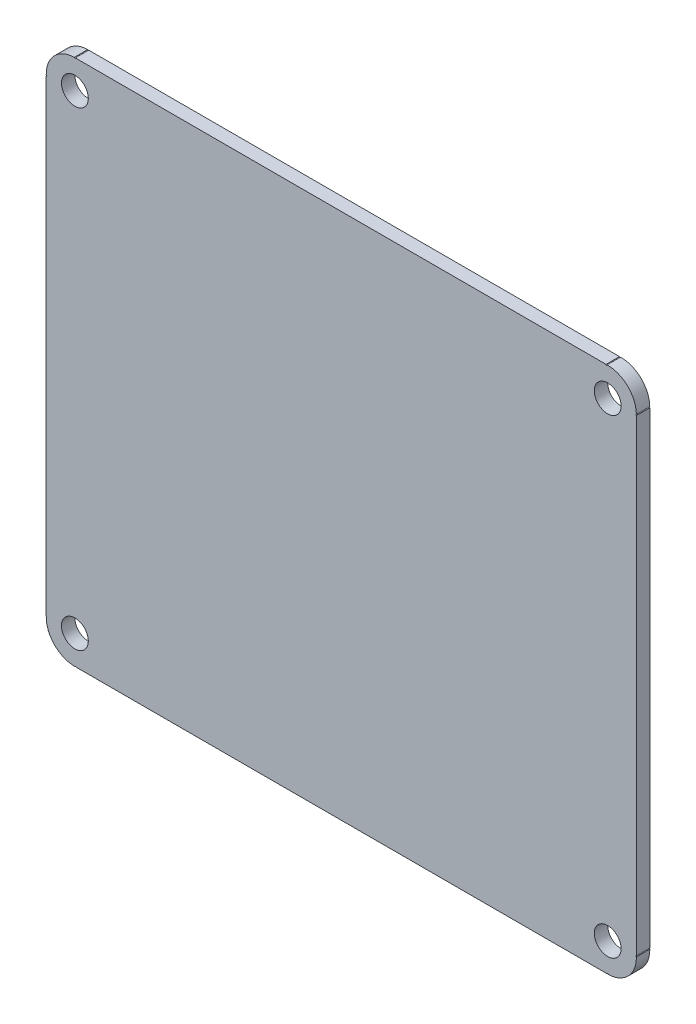
from build123d import *

# Parameters (mm, degrees)
EXTRUDE_1_DEPTH     = 1.6
VIAHOLELAYER_R      = 1.6
CUT_EXTRUDE_2_DEPTH = 1.6


# Read off the part's stored shape, not the designer's step: 凸台-拉伸1
with BuildPart() as part:
    # 凸台-拉伸1 outline → 凸台-拉伸1 (new body)
    with BuildSketch(Plane.XY):
        with BuildLine():
            Line((28.205781396, 97.600023259), (28.205781396, 41.846499647))
            ThreePointArc((28.205781396, 41.846499647), (28.269280711, 41.783294645), (28.206371386, 41.719502388))
            ThreePointArc((28.206371386, 41.719502388), (29.251799434, 39.322351184), (31.68600117, 38.36636185))
            ThreePointArc((31.68600117, 38.36636185), (31.7485964, 38.431616297), (31.81297676, 38.3681224))
            Line((31.81297676, 38.3681224), (95.0595, 38.3681224))
            ThreePointArc((95.0595, 38.3681224), (95.123585364, 38.431619702), (95.186489208, 38.366951722))
            ThreePointArc((95.186489208, 38.366951722), (95.186493897, 38.366661387), (95.186497259, 38.366371034))
            ThreePointArc((95.186497259, 38.366371034), (97.583648579, 39.411799201), (98.539637791, 41.846001151))
            ThreePointArc((98.539637791, 41.846001151), (98.474383338, 41.908596378), (98.537877235, 41.972976741))
            Line((98.537877235, 41.972976741), (98.537877235, 97.726500353))
            ThreePointArc((98.537877235, 97.726500353), (98.474379933, 97.79058572), (98.539047919, 97.85348956))
            ThreePointArc((98.539047919, 97.85348956), (98.539338257, 97.85349425), (98.539628614, 97.853497612))
            ThreePointArc((98.539628614, 97.853497612), (97.494200566, 100.250648816), (95.05999883, 101.20663815))
            ThreePointArc((95.05999883, 101.20663815), (94.9974036, 101.141383703), (94.93302324, 101.2048776))
            Line((94.93302324, 101.2048776), (31.6865, 101.2048776))
            ThreePointArc((31.6865, 101.2048776), (31.622414636, 101.141380298), (31.559510792, 101.206048278))
            ThreePointArc((31.559510792, 101.206048278), (31.559506103, 101.206338613), (31.559502741, 101.206628966))
            ThreePointArc((31.559502741, 101.206628966), (29.162358971, 100.161208634), (28.206361808, 97.727020607))
            ThreePointArc((28.206361808, 97.727020607), (28.206656954, 97.727017223), (28.206952081, 97.727012467))
            ThreePointArc((28.206952081, 97.727012467), (28.271622765, 97.663523259), (28.206952081, 97.600034052))
            ThreePointArc((28.206952081, 97.600034052), (28.206366763, 97.600025958), (28.205781396, 97.600023259))
        make_face()
    extrude(amount=EXTRUDE_1_DEPTH)

    # ViaHoleLayer → 切除-拉伸2 (cut)
    with BuildSketch(Plane.XY):
        with Locations((95.12300254, 97.79)):
            Circle(VIAHOLELAYER_R)
        with Locations((95.12300254, 41.783)):
            Circle(VIAHOLELAYER_R)
        with Locations((31.623, 41.783)):
            Circle(VIAHOLELAYER_R)
        with Locations((31.623, 97.79)):
            Circle(VIAHOLELAYER_R)
    extrude(amount=CUT_EXTRUDE_2_DEPTH, mode=Mode.SUBTRACT)


solid = part.part
